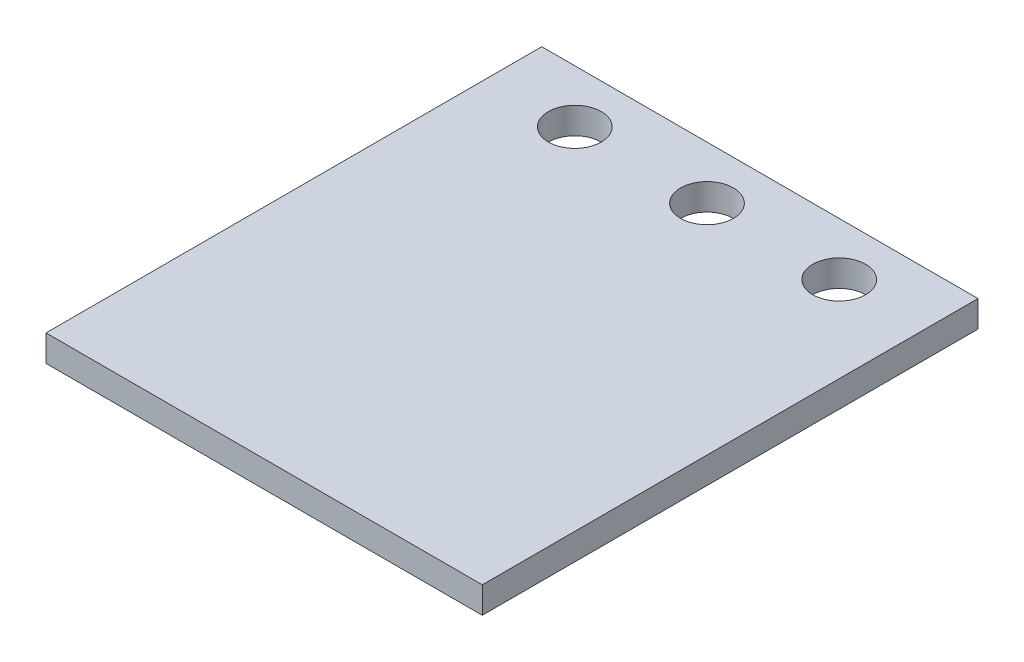
from build123d import *

# Parameters (mm, degrees)
CROQUIS2_W              = 330
CROQUIS2_H              = 20
SALIENTE_EXTRUIR1_DEPTH = 375
CORTAR_EXTRUIR1_REACH   = 401.805
CROQUIS3_R              = 20


with BuildPart() as part:
    # Croquis2 → Saliente-Extruir1 (new body)
    with BuildSketch(Plane(origin=(0, 0, 360), x_dir=(-1, 0, 0), z_dir=(0, 0, -1))):
        with Locations((7.754092983, 192.834413862)):
            Rectangle(CROQUIS2_W, CROQUIS2_H)
    extrude(amount=SALIENTE_EXTRUIR1_DEPTH)

    # Croquis3 → Cortar-Extruir1 (cut, up to next)
    with BuildSketch(Plane(origin=(0, 202.834413862, 0), x_dir=(1, 0, 0), z_dir=(0, 1, 0)), mode=Mode.PRIVATE) as cortar_extruir1_sk1:
        with Locations((-107.754092983, -25)):
            Circle(CROQUIS3_R)
    cortar_extruir1_tool1 = extrude(cortar_extruir1_sk1.sketch, amount=-CORTAR_EXTRUIR1_REACH, mode=Mode.PRIVATE) & part.part
    # Croquis3 → Cortar-Extruir1 (cut, up to next)
    with BuildSketch(Plane(origin=(0, 202.834413862, 0), x_dir=(1, 0, 0), z_dir=(0, 1, 0)), mode=Mode.PRIVATE) as cortar_extruir1_sk2:
        with Locations((-7.754092983, -25)):
            Circle(CROQUIS3_R)
    cortar_extruir1_tool2 = extrude(cortar_extruir1_sk2.sketch, amount=-CORTAR_EXTRUIR1_REACH, mode=Mode.PRIVATE) & part.part
    # Croquis3 → Cortar-Extruir1 (cut, up to next)
    with BuildSketch(Plane(origin=(0, 202.834413862, 0), x_dir=(1, 0, 0), z_dir=(0, 1, 0)), mode=Mode.PRIVATE) as cortar_extruir1_sk3:
        with Locations((92.245907017, -25)):
            Circle(CROQUIS3_R)
    cortar_extruir1_tool3 = extrude(cortar_extruir1_sk3.sketch, amount=-CORTAR_EXTRUIR1_REACH, mode=Mode.PRIVATE) & part.part
    add(cortar_extruir1_tool1.solids().sort_by_distance((-107.754093, 202.834414, 25))[0], mode=Mode.SUBTRACT)
    add(cortar_extruir1_tool2.solids().sort_by_distance((-7.754093, 202.834414, 25))[0], mode=Mode.SUBTRACT)
    add(cortar_extruir1_tool3.solids().sort_by_distance((92.245907, 202.834414, 25))[0], mode=Mode.SUBTRACT)


solid = part.part
